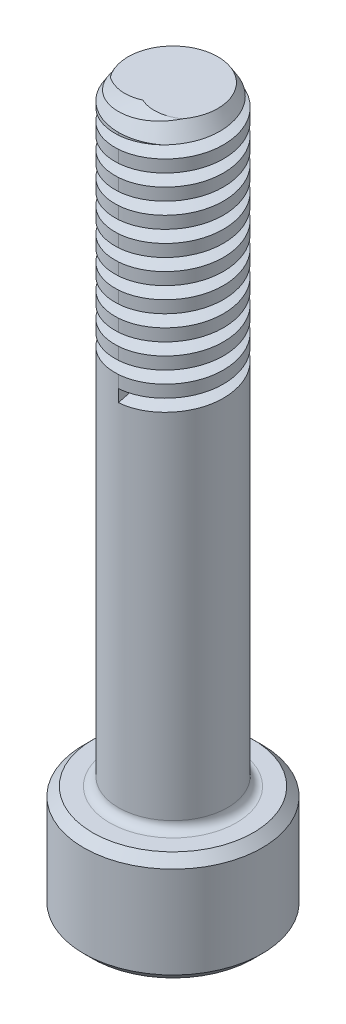
from build123d import *

# Parameters (mm, degrees)
CUT_SWEEP1_PITCH   = 0.635
CUT_EXTRUDE1_DEPTH = 1.2954
FILLET1_R          = 0.2286
FILLET2_R          = 0.396875794
CHAMFER2_SIZE      = 0.2286
CHAMFER3_SIZE      = 0.127


with BuildPart() as part:
    # Sketch1 → Revolve1 (revolve)
    with BuildSketch(Plane.XY, mode=Mode.PRIVATE) as revolve1_sk:
        Polygon((0, 0), (0, 18.7198), (1.4224, 18.7198), (1.4224, 2.8448), (2.3241, 2.8448), (2.3241, 0), align=None)
    revolve(revolve1_sk.sketch.rotate(Axis((0, 0, 0), (0, 1, 0)), 90), axis=Axis((0, 0, 0), (0, 1, 0)))

    # Cut-Sweep1: arcs per turn and ends read off the stored shape
    # Cut-Sweep1: the profile of Sketch3 profile screwed along a right-hand helix through 11 turns, 6 arcs to a turn; built about Z, then put on its axis
    cut_sweep1_z = Axis((0, 0, 0), (0, 0, 1))
    cut_sweep1_corners = [(1.4227, 0, -0.476175), (1.4227, 0, -0.793825), (0.78739873, 0, -0.635)]
    with BuildLine(mode=Mode.PRIVATE) as cut_sweep1_profile:
        Line(cut_sweep1_corners[0], cut_sweep1_corners[1])
        Line(cut_sweep1_corners[1], cut_sweep1_corners[2])
        Line(cut_sweep1_corners[2], cut_sweep1_corners[0])
    cut_sweep1_cap = Face(cut_sweep1_profile.wire())
    cut_sweep1_turn_angles = [0, 30, 60, 90, 120, 150, 180, 210, 240, 270, 300, 330, 360]
    cut_sweep1_turn_weights = [1, 0.8660254037844387, 1, 0.8660254037844387, 1, 0.8660254037844387, 1, 0.8660254037844387, 1, 0.8660254037844387, 1, 0.8660254037844387, 1]
    cut_sweep1_turn_rails = [Edge.make_bspline([Vector(p[0], p[1], 0).rotate(cut_sweep1_z, cut_sweep1_turn_angles[k]) / cut_sweep1_turn_weights[k] + Vector(0, 0, p[2] + CUT_SWEEP1_PITCH * cut_sweep1_turn_angles[k] / 360) for k in range(13)], [0, 0, 0, 1, 1, 2, 2, 3, 3, 4, 4, 5, 5, 6, 6, 6], 2, cut_sweep1_turn_weights) for p in cut_sweep1_corners]
    cut_sweep1_turn_sides = [Face.make_surface_from_curves(cut_sweep1_turn_rails[p[0]], cut_sweep1_turn_rails[p[1]]) for p in [(0, 1), (1, 2), (2, 0)]]
    cut_sweep1 = Plane(origin=(0, 18.7198, 0), x_dir=(0, 0, 1), z_dir=(0, -1, 0)) * Solid(Shell([*[p.moved(Location((0, 0, CUT_SWEEP1_PITCH * i))) for i in range(11) for p in cut_sweep1_turn_sides], cut_sweep1_cap, cut_sweep1_cap.rotate(cut_sweep1_z, 3960).moved(Location((0, 0, CUT_SWEEP1_PITCH * 3960 / 360)))]))
    add(cut_sweep1, mode=Mode.SUBTRACT)

    # Sketch4 → Cut-Extrude1 (cut)
    with BuildSketch(Plane(origin=(0, 0, 0), x_dir=(1, 0, 0), z_dir=(0, 1, 0))):
        Polygon((0, 1.378481503), (-1.1938, 0.689240751), (-1.1938, -0.689240751), (0, -1.378481503), (1.1938, -0.689240751), (1.1938, 0.689240751), align=None)
    extrude(amount=CUT_EXTRUDE1_DEPTH, mode=Mode.SUBTRACT)

    # Fillet1
    fillet1_edges = [part.edges().sort_by_distance(p)[0] for p in [
        (0, 2.8448, 1.4224),
    ]]
    fillet(fillet1_edges, radius=FILLET1_R)

    # Fillet2
    fillet2_edges = [part.edges().sort_by_distance(p)[0] for p in [
        (1.1938, 0.6477, -0.689240751),
        (0, 0.6477, -1.378481503),
        (-1.1938, 0.6477, -0.689240751),
        (-1.1938, 0.6477, 0.689240751),
        (0, 0.6477, 1.378481503),
        (1.1938, 0.6477, 0.689240751),
        (0.5969, 1.2954, -1.033861127),
        (-0.5969, 1.2954, -1.033861127),
        (-1.1938, 1.2954, 0),
        (-0.5969, 1.2954, 1.033861127),
        (0.5969, 1.2954, 1.033861127),
        (1.1938, 1.2954, 0),
    ]]
    fillet(fillet2_edges, radius=FILLET2_R)

    # Chamfer1: read off the stored shape, not the designer's step
    # Chamfer1 outline → Chamfer1 (revolve, cut)
    with BuildSketch(Plane.XY):
        Polygon((1.4224, 18.7198), (1.168399492, 18.7198), (1.4224, 18.308376279), align=None)
    revolve(axis=Axis((0, 0, 0), (0, 1, 0)), mode=Mode.SUBTRACT)

    # Chamfer2
    chamfer2_edges = [part.edges().sort_by_distance(p)[0] for p in [
        (0, 0, 2.3241),
        (0, 2.8448, 2.3241),
    ]]
    chamfer(chamfer2_edges, length=CHAMFER2_SIZE)

    # Chamfer3
    chamfer3_edges = [part.edges().sort_by_distance(p)[0] for p in [
        (0.5969, 0, -1.033861127),
        (-0.5969, 0, -1.033861127),
        (-1.1938, 0, 0),
        (-0.5969, 0, 1.033861127),
        (0.5969, 0, 1.033861127),
        (1.1938, 0, 0),
        (0, 0, -1.317084604),
        (1.140628726, 0, -0.658542302),
        (1.140628726, 0, 0.658542302),
        (0, 0, 1.317084604),
        (-1.140628726, 0, 0.658542302),
        (-1.140628726, 0, -0.658542302),
    ]]
    chamfer(chamfer3_edges, length=CHAMFER3_SIZE)


solid = part.part
